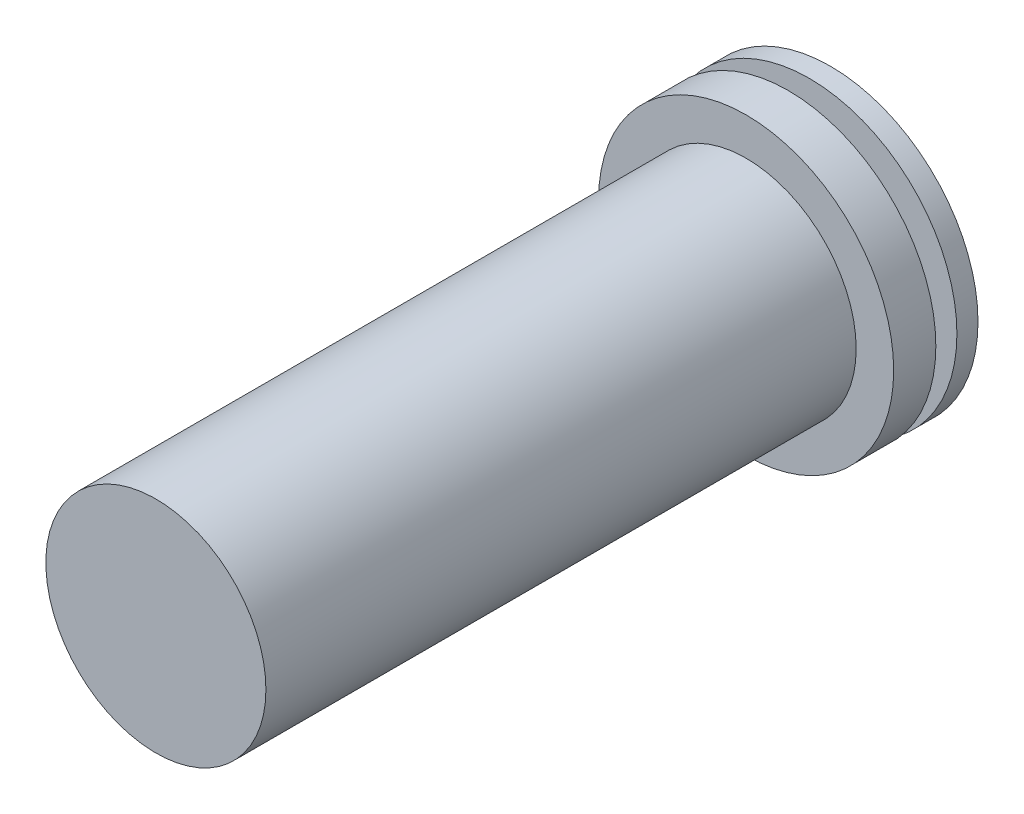
from build123d import *

# Parameters (mm, degrees)
SKETCH1_R                = 5.22
BOSS_EXTRUDE1_DEPTH      = 28
SKETCH2_R                = 7
BOSS_EXTRUDE2_DEPTH      = 4
CUT_EXTRUDE2_START       = -3
CUT_EXTRUDE2_OUTLINE_R   = 7
CUT_EXTRUDE2_OUTLINE_R_2 = 5.165
CUT_EXTRUDE2_DEPTH       = 1


# Read off the part's stored shape, not the designer's step: Cut-Extrude2
with BuildPart() as part:
    # Sketch1 → Boss-Extrude1 (new body)
    with BuildSketch(Plane.XY):
        Circle(SKETCH1_R)
    extrude(amount=BOSS_EXTRUDE1_DEPTH)

    # Sketch2 → Boss-Extrude2 (add)
    with BuildSketch(Plane(origin=(0, 0, 0), x_dir=(-1, 0, 0), z_dir=(0, 0, -1))):
        Circle(SKETCH2_R)
    extrude(amount=BOSS_EXTRUDE2_DEPTH)

    # Cut-Extrude2 outline → Cut-Extrude2 (cut)
    with BuildSketch(Plane.XY.offset(CUT_EXTRUDE2_START)):
        Circle(CUT_EXTRUDE2_OUTLINE_R)
        Circle(CUT_EXTRUDE2_OUTLINE_R_2, mode=Mode.SUBTRACT)
    extrude(amount=CUT_EXTRUDE2_DEPTH, mode=Mode.SUBTRACT)


solid = part.part
